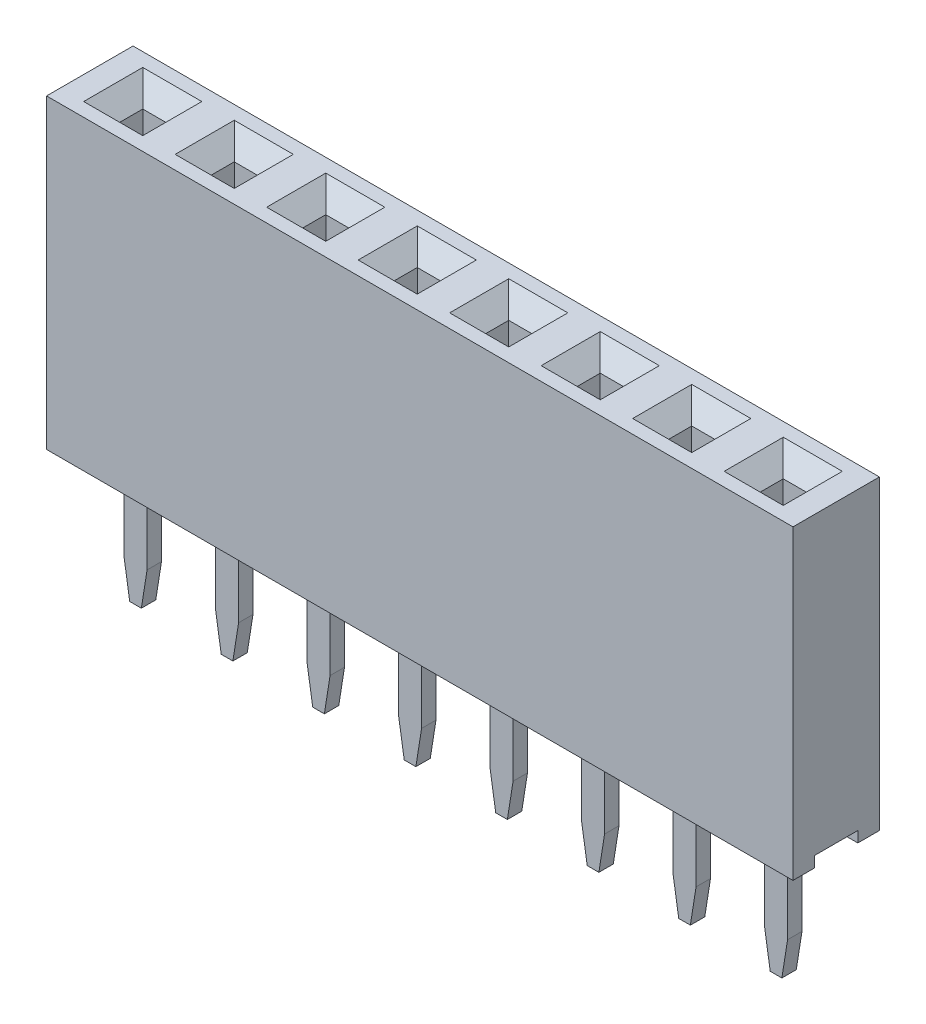
from build123d import *
from OCP.BRepFilletAPI import BRepFilletAPI_MakeChamfer

# Parameters (mm, degrees)
SKETCH1_W           = 20.72
SKETCH1_H           = 2.4
BOSS_EXTRUDE1_DEPTH = 8.5
SKETCH3_W           = 20.72
SKETCH3_H           = 1.2
CUT_EXTRUDE1_DEPTH  = 0.3
SKETCH4_W           = 0.64
SKETCH4_H           = 0.64
CUT_EXTRUDE2_DEPTH  = 6
CHAMFER2_SIZE       = 0.5
SKETCH5_W           = 0.64
SKETCH5_H           = 0.4
BOSS_EXTRUDE2_DEPTH = 3.8
CHAMFER3_SIZE       = 1
CHAMFER3_SIZE2      = 0.15838444


with BuildPart() as part:
    # Sketch1 → Boss-Extrude1 (new body)
    with BuildSketch(Plane(origin=(0, 0, 0), x_dir=(1, 0, 0), z_dir=(0, 1, 0))):
        with Locations((10.36, 1.2)):
            Rectangle(SKETCH1_W, SKETCH1_H)
    extrude(amount=BOSS_EXTRUDE1_DEPTH)

    # Sketch3 → Cut-Extrude1 (cut)
    with BuildSketch(Plane.XZ):
        with Locations((10.36, -1.2)):
            Rectangle(SKETCH3_W, SKETCH3_H)
    extrude(amount=-CUT_EXTRUDE1_DEPTH, mode=Mode.SUBTRACT)

    # Sketch4 → Cut-Extrude2 (cut)
    with BuildSketch(Plane(origin=(0, 8.5, 0), x_dir=(1, 0, 0), z_dir=(0, 1, 0))):
        with Locations((4.01, 1.2)):
            Rectangle(SKETCH4_W, SKETCH4_H)
        with Locations((1.47, 1.2)):
            Rectangle(SKETCH4_W, SKETCH4_H)
        with Locations((6.55, 1.2)):
            Rectangle(SKETCH4_W, SKETCH4_H)
        with Locations((9.09, 1.2)):
            Rectangle(SKETCH4_W, SKETCH4_H)
        with Locations((11.63, 1.2)):
            Rectangle(SKETCH4_W, SKETCH4_H)
        with Locations((14.17, 1.2)):
            Rectangle(SKETCH4_W, SKETCH4_H)
        with Locations((16.71, 1.2)):
            Rectangle(SKETCH4_W, SKETCH4_H)
        with Locations((19.25, 1.2)):
            Rectangle(SKETCH4_W, SKETCH4_H)
    extrude(amount=-CUT_EXTRUDE2_DEPTH, mode=Mode.SUBTRACT)

    # Chamfer2
    chamfer2_edges = [part.edges().sort_by_distance(p)[0] for p in [
        (1.47, 8.5, -1.52),
        (1.15, 8.5, -1.2),
        (1.47, 8.5, -0.88),
        (1.79, 8.5, -1.2),
        (4.01, 8.5, -1.52),
        (3.69, 8.5, -1.2),
        (4.01, 8.5, -0.88),
        (4.33, 8.5, -1.2),
        (6.55, 8.5, -1.52),
        (6.23, 8.5, -1.2),
        (6.55, 8.5, -0.88),
        (6.87, 8.5, -1.2),
        (8.77, 8.5, -1.2),
        (9.09, 8.5, -0.88),
        (9.41, 8.5, -1.2),
        (9.09, 8.5, -1.52),
        (11.63, 8.5, -1.52),
        (11.31, 8.5, -1.2),
        (11.63, 8.5, -0.88),
        (11.95, 8.5, -1.2),
        (14.49, 8.5, -1.2),
        (14.17, 8.5, -1.52),
        (13.85, 8.5, -1.2),
        (14.17, 8.5, -0.88),
        (16.71, 8.5, -1.52),
        (16.39, 8.5, -1.2),
        (16.71, 8.5, -0.88),
        (17.03, 8.5, -1.2),
        (19.57, 8.5, -1.2),
        (19.25, 8.5, -1.52),
        (18.93, 8.5, -1.2),
        (19.25, 8.5, -0.88),
    ]]
    chamfer(chamfer2_edges, length=CHAMFER2_SIZE)

    # Sketch5 → Boss-Extrude2 (add)
    with BuildSketch(Plane.XZ.offset(-0.3)):
        with Locations((4.01, -1.2)):
            Rectangle(SKETCH5_W, SKETCH5_H)
        with Locations((1.47, -1.2)):
            Rectangle(SKETCH5_W, SKETCH5_H)
        with Locations((6.55, -1.2)):
            Rectangle(SKETCH5_W, SKETCH5_H)
        with Locations((9.09, -1.2)):
            Rectangle(SKETCH5_W, SKETCH5_H)
        with Locations((11.63, -1.2)):
            Rectangle(SKETCH5_W, SKETCH5_H)
        with Locations((14.17, -1.2)):
            Rectangle(SKETCH5_W, SKETCH5_H)
        with Locations((16.71, -1.2)):
            Rectangle(SKETCH5_W, SKETCH5_H)
        with Locations((19.25, -1.2)):
            Rectangle(SKETCH5_W, SKETCH5_H)
    extrude(amount=BOSS_EXTRUDE2_DEPTH)

    # Chamfer3: one chamfer whose edges measure the first distance from different faces: ONE call of the kernel's chamfer builder (chamfer() names one face for all edges)
    chamfer3_edges_1 = [part.edges().sort_by_distance(p)[0] for p in [
        (19.57, -3.5, -1.2),
    ]]
    chamfer3_side_1 = [part.faces().sort_by_distance(p)[0] for p in [
        (19.57, -1.6, -1.2),
    ]]
    chamfer3_edges_2 = [part.edges().sort_by_distance(p)[0] for p in [
        (18.93, -3.5, -1.2),
    ]]
    chamfer3_side_2 = [part.faces().sort_by_distance(p)[0] for p in [
        (18.93, -1.6, -1.2),
    ]]
    chamfer3_edges_3 = [part.edges().sort_by_distance(p)[0] for p in [
        (17.03, -3.5, -1.2),
    ]]
    chamfer3_side_3 = [part.faces().sort_by_distance(p)[0] for p in [
        (17.03, -1.6, -1.2),
    ]]
    chamfer3_edges_4 = [part.edges().sort_by_distance(p)[0] for p in [
        (16.39, -3.5, -1.2),
    ]]
    chamfer3_side_4 = [part.faces().sort_by_distance(p)[0] for p in [
        (16.39, -1.6, -1.2),
    ]]
    chamfer3_edges_5 = [part.edges().sort_by_distance(p)[0] for p in [
        (14.49, -3.5, -1.2),
    ]]
    chamfer3_side_5 = [part.faces().sort_by_distance(p)[0] for p in [
        (14.49, -1.6, -1.2),
    ]]
    chamfer3_edges_6 = [part.edges().sort_by_distance(p)[0] for p in [
        (13.85, -3.5, -1.2),
    ]]
    chamfer3_side_6 = [part.faces().sort_by_distance(p)[0] for p in [
        (13.85, -1.6, -1.2),
    ]]
    chamfer3_edges_7 = [part.edges().sort_by_distance(p)[0] for p in [
        (11.95, -3.5, -1.2),
    ]]
    chamfer3_side_7 = [part.faces().sort_by_distance(p)[0] for p in [
        (11.95, -1.6, -1.2),
    ]]
    chamfer3_edges_8 = [part.edges().sort_by_distance(p)[0] for p in [
        (11.31, -3.5, -1.2),
    ]]
    chamfer3_side_8 = [part.faces().sort_by_distance(p)[0] for p in [
        (11.31, -1.6, -1.2),
    ]]
    chamfer3_edges_9 = [part.edges().sort_by_distance(p)[0] for p in [
        (9.41, -3.5, -1.2),
    ]]
    chamfer3_side_9 = [part.faces().sort_by_distance(p)[0] for p in [
        (9.41, -1.6, -1.2),
    ]]
    chamfer3_edges_10 = [part.edges().sort_by_distance(p)[0] for p in [
        (8.77, -3.5, -1.2),
    ]]
    chamfer3_side_10 = [part.faces().sort_by_distance(p)[0] for p in [
        (8.77, -1.6, -1.2),
    ]]
    chamfer3_edges_11 = [part.edges().sort_by_distance(p)[0] for p in [
        (6.87, -3.5, -1.2),
    ]]
    chamfer3_side_11 = [part.faces().sort_by_distance(p)[0] for p in [
        (6.87, -1.6, -1.2),
    ]]
    chamfer3_edges_12 = [part.edges().sort_by_distance(p)[0] for p in [
        (6.23, -3.5, -1.2),
    ]]
    chamfer3_side_12 = [part.faces().sort_by_distance(p)[0] for p in [
        (6.23, -1.6, -1.2),
    ]]
    chamfer3_edges_13 = [part.edges().sort_by_distance(p)[0] for p in [
        (4.33, -3.5, -1.2),
    ]]
    chamfer3_side_13 = [part.faces().sort_by_distance(p)[0] for p in [
        (4.33, -1.6, -1.2),
    ]]
    chamfer3_edges_14 = [part.edges().sort_by_distance(p)[0] for p in [
        (3.69, -3.5, -1.2),
    ]]
    chamfer3_side_14 = [part.faces().sort_by_distance(p)[0] for p in [
        (3.69, -1.6, -1.2),
    ]]
    chamfer3_edges_15 = [part.edges().sort_by_distance(p)[0] for p in [
        (1.79, -3.5, -1.2),
    ]]
    chamfer3_side_15 = [part.faces().sort_by_distance(p)[0] for p in [
        (1.79, -1.6, -1.2),
    ]]
    chamfer3_edges_16 = [part.edges().sort_by_distance(p)[0] for p in [
        (1.15, -3.5, -1.2),
    ]]
    chamfer3_side_16 = [part.faces().sort_by_distance(p)[0] for p in [
        (1.15, -1.6, -1.2),
    ]]
    chamfer3 = BRepFilletAPI_MakeChamfer(part.part.solid().wrapped)
    for e in chamfer3_edges_1:
        chamfer3.Add(CHAMFER3_SIZE, CHAMFER3_SIZE2, e.wrapped, chamfer3_side_1[0].wrapped)  # the first distance lies on this face
    for e in chamfer3_edges_2:
        chamfer3.Add(CHAMFER3_SIZE, CHAMFER3_SIZE2, e.wrapped, chamfer3_side_2[0].wrapped)  # the first distance lies on this face
    for e in chamfer3_edges_3:
        chamfer3.Add(CHAMFER3_SIZE, CHAMFER3_SIZE2, e.wrapped, chamfer3_side_3[0].wrapped)  # the first distance lies on this face
    for e in chamfer3_edges_4:
        chamfer3.Add(CHAMFER3_SIZE, CHAMFER3_SIZE2, e.wrapped, chamfer3_side_4[0].wrapped)  # the first distance lies on this face
    for e in chamfer3_edges_5:
        chamfer3.Add(CHAMFER3_SIZE, CHAMFER3_SIZE2, e.wrapped, chamfer3_side_5[0].wrapped)  # the first distance lies on this face
    for e in chamfer3_edges_6:
        chamfer3.Add(CHAMFER3_SIZE, CHAMFER3_SIZE2, e.wrapped, chamfer3_side_6[0].wrapped)  # the first distance lies on this face
    for e in chamfer3_edges_7:
        chamfer3.Add(CHAMFER3_SIZE, CHAMFER3_SIZE2, e.wrapped, chamfer3_side_7[0].wrapped)  # the first distance lies on this face
    for e in chamfer3_edges_8:
        chamfer3.Add(CHAMFER3_SIZE, CHAMFER3_SIZE2, e.wrapped, chamfer3_side_8[0].wrapped)  # the first distance lies on this face
    for e in chamfer3_edges_9:
        chamfer3.Add(CHAMFER3_SIZE, CHAMFER3_SIZE2, e.wrapped, chamfer3_side_9[0].wrapped)  # the first distance lies on this face
    for e in chamfer3_edges_10:
        chamfer3.Add(CHAMFER3_SIZE, CHAMFER3_SIZE2, e.wrapped, chamfer3_side_10[0].wrapped)  # the first distance lies on this face
    for e in chamfer3_edges_11:
        chamfer3.Add(CHAMFER3_SIZE, CHAMFER3_SIZE2, e.wrapped, chamfer3_side_11[0].wrapped)  # the first distance lies on this face
    for e in chamfer3_edges_12:
        chamfer3.Add(CHAMFER3_SIZE, CHAMFER3_SIZE2, e.wrapped, chamfer3_side_12[0].wrapped)  # the first distance lies on this face
    for e in chamfer3_edges_13:
        chamfer3.Add(CHAMFER3_SIZE, CHAMFER3_SIZE2, e.wrapped, chamfer3_side_13[0].wrapped)  # the first distance lies on this face
    for e in chamfer3_edges_14:
        chamfer3.Add(CHAMFER3_SIZE, CHAMFER3_SIZE2, e.wrapped, chamfer3_side_14[0].wrapped)  # the first distance lies on this face
    for e in chamfer3_edges_15:
        chamfer3.Add(CHAMFER3_SIZE, CHAMFER3_SIZE2, e.wrapped, chamfer3_side_15[0].wrapped)  # the first distance lies on this face
    for e in chamfer3_edges_16:
        chamfer3.Add(CHAMFER3_SIZE, CHAMFER3_SIZE2, e.wrapped, chamfer3_side_16[0].wrapped)  # the first distance lies on this face
    add(Compound.cast(chamfer3.Shape()), mode=Mode.REPLACE)


solid = part.part
